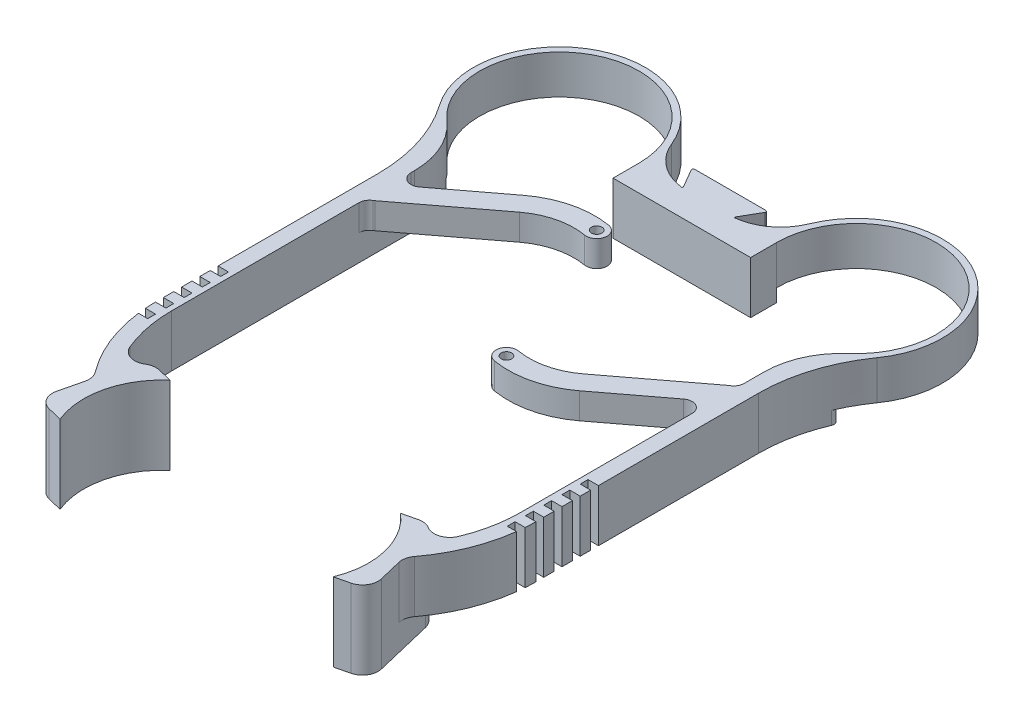
from build123d import *

# Parameters (mm, degrees)
BOSS_EXTRUDE1_DEPTH = 10
FILLET2_R           = 30
SKETCH6_R           = 1
BOSS_EXTRUDE2_DEPTH = 5
SKETCH4_W           = 2
SKETCH4_H           = 1.5
CUT_EXTRUDE1_DEPTH  = 99.900202224
FILLET3_R           = 15
CUT_REVOLVE1_START  = -1
CUT_REVOLVE1_DEPTH  = 3.5
FILLET1_R           = 10
FILLET4_R           = 1
FILLET5_R           = 2
BOSS_EXTRUDE3_START = -10
BOSS_EXTRUDE3_DEPTH = 15
DELETEFACE1_DEPTH   = 11
FILLET6_R           = 3
FILLET7_R           = 3
BOSS_EXTRUDE4_START = -10
SKETCH11_W          = 10
SKETCH11_H          = 0.3
BOSS_EXTRUDE4_DEPTH = 8
FILLET8_R           = 0.3


with BuildPart() as part:
    # Sketch2 → Boss-Extrude1 (new body)
    with BuildSketch(Plane(origin=(0, 0, 0), x_dir=(1, 0, 0), z_dir=(0, 1, 0))):
        with BuildLine():
            Line((-15, 2.5), (-15, -2.5))
            Line((-15, -2.5), (15, -2.5))
            Line((15, -2.5), (15, 2.5))
            Line((15, 2.5), (-12, 2.5))
            ThreePointArc((-12, 2.5), (-36.874067112, 16.717067208), (-36.5, -11.93086969))
            Line((-36.5, -11.93086969), (-36.5, -66.907529531))
            ThreePointArc((-36.5, -66.907529531), (-34.28320825, -78.052094241), (-27.970319449, -87.5))
            Line((-27.970319449, -87.5), (-25.848999105, -85.378679656))
            ThreePointArc((-25.848999105, -85.378679656), (-31.511569653, -76.904043944), (-33.5, -66.907529531))
            Line((-33.5, -66.907529531), (-33.5, -10.039936204))
            ThreePointArc((-33.5, -10.039936204), (-36.074628704, 13.674748319), (-15, 2.5))
        make_face()
    boss_extrude1 = extrude(amount=BOSS_EXTRUDE1_DEPTH)

    # Mirror2: Boss-Extrude1 across plane
    add(boss_extrude1.mirror(Plane(origin=(0, 0, 0), x_dir=(0, 0, 1), z_dir=(1, 0, 0))))

    # Fillet2
    fillet2_edges = [part.edges().sort_by_distance(p)[0] for p in [
        (-36.5, 5, 11.93086969),
        (36.5, 5, 11.93086969),
    ]]
    fillet(fillet2_edges, radius=FILLET2_R)

    # Sketch6 → Boss-Extrude2 (add)
    # profile 1 of 2: a face of its own
    with BuildSketch(Plane(origin=(0, 10, 0), x_dir=(1, 0, 0), z_dir=(0, 1, 0))):
        with BuildLine():
            Line((-32.29175747, -29.0937848), (-16.524124365, -17.1403988))
            ThreePointArc((-16.524124365, -17.1403988), (-11.748018495, -14.869514069), (-6.462616651, -14.688870483))
            ThreePointArc((-6.462616651, -14.688870483), (-4.151991915, -13.057609213), (-5.783253184, -10.746984477))
            ThreePointArc((-5.783253184, -10.746984477), (-12.694932518, -10.983210705), (-18.940609425, -13.9528292))
            Line((-18.940609425, -13.9528292), (-34.70824253, -25.9062152))
            ThreePointArc((-34.70824253, -25.9062152), (-35.0937848, -28.70824253), (-32.29175747, -29.0937848))
        make_face()
        with Locations(Location((-6.122934918, -12.71792748, 0), (0, 0, 270))):
            Circle(SKETCH6_R, mode=Mode.SUBTRACT)
    # profile 2 of 2: a face of its own
    with BuildSketch(Plane(origin=(0, 10, 0), x_dir=(1, 0, 0), z_dir=(0, 1, 0))):
        with BuildLine():
            Line((32.29175747, -25.9062152), (16.524124365, -37.8596012))
            ThreePointArc((16.524124365, -37.8596012), (11.748018495, -40.130485931), (6.462616651, -40.311129517))
            ThreePointArc((6.462616651, -40.311129517), (4.151991915, -41.942390787), (5.783253184, -44.253015523))
            ThreePointArc((5.783253184, -44.253015523), (12.694932518, -44.016789295), (18.940609425, -41.0471708))
            Line((18.940609425, -41.0471708), (34.70824253, -29.0937848))
            ThreePointArc((34.70824253, -29.0937848), (35.0937848, -26.29175747), (32.29175747, -25.9062152))
        make_face()
        with Locations(Location((6.122934918, -42.28207252, 0), (0, 0, 270))):
            Circle(SKETCH6_R, mode=Mode.SUBTRACT)
    extrude(amount=-BOSS_EXTRUDE2_DEPTH)

    # Sketch4 → Cut-Extrude1 (cut, through all)
    with BuildSketch(Plane(origin=(0, 10, 0), x_dir=(1, 0, 0), z_dir=(0, 1, 0))):
        with BuildLine():
            Line((-13.2, 2.5), (-13.2, -2.5))
            Line((-13.2, -2.5), (-14.040055325, -2.5))
            ThreePointArc((-14.040055325, -2.5), (-43.588524672, 5.0350391), (-13.2, 2.5))
        make_face()
        with Locations((-35.5, -59.25)):
            Rectangle(SKETCH4_W, SKETCH4_H)
        with Locations((-35.5, -62.75)):
            Rectangle(SKETCH4_W, SKETCH4_H)
        with Locations((-35.5, -55.75)):
            Rectangle(SKETCH4_W, SKETCH4_H)
        with Locations((-35.5, -66.25)):
            Rectangle(SKETCH4_W, SKETCH4_H)
        with Locations((-35.5, -69.75)):
            Rectangle(SKETCH4_W, SKETCH4_H)
        with Locations((35.5, -69.75)):
            Rectangle(SKETCH4_W, SKETCH4_H)
        with Locations((35.5, -66.25)):
            Rectangle(SKETCH4_W, SKETCH4_H)
        with Locations((35.5, -62.75)):
            Rectangle(SKETCH4_W, SKETCH4_H)
        with Locations((35.5, -55.75)):
            Rectangle(SKETCH4_W, SKETCH4_H)
        with Locations((35.5, -59.25)):
            Rectangle(SKETCH4_W, SKETCH4_H)
        with BuildLine():
            Line((13.2, -2.5), (14.040055325, -2.5))
            ThreePointArc((14.040055325, -2.5), (43.588524672, 5.0350391), (13.2, 2.5))
            Line((13.2, 2.5), (13.2, -2.5))
        make_face()
    extrude(amount=-CUT_EXTRUDE1_DEPTH, mode=Mode.SUBTRACT)

    # Fillet3
    fillet3_edges = [part.edges().sort_by_distance(p)[0] for p in [
        (33.5, 5, 11.959944675),
        (-33.5, 5, 11.959944675),
    ]]
    fillet(fillet3_edges, radius=FILLET3_R)

    # Cut-Revolve1: read off the stored shape, not the designer's step
    # Cut-Revolve1 outline → Cut-Revolve1 (cut)
    with BuildSketch(Plane(origin=(0, 0, 0), x_dir=(1, 0, 0), z_dir=(0, 1, 0)).offset(CUT_REVOLVE1_START)):
        with BuildLine():
            ThreePointArc((-41.983870968, -7.00974362), (-39.626617248, -9.683939782), (-36.75, -11.789419162))
            Line((-36.75, -11.789419162), (-36.469117037, -11.3029156))
            ThreePointArc((-36.469117037, -11.3029156), (-37.473434742, -10.092280811), (-38.599009901, -8.993476368))
            ThreePointArc((-38.599009901, -8.993476368), (-34.807739235, 16.439240501), (-13.2, 2.5))
            Line((-13.2, 2.5), (-12, 2.5))
            ThreePointArc((-12, 2.5), (-33.488292745, 18.227903086), (-41.983870968, -7.00974362))
        make_face()
    cut_revolve1 = extrude(amount=CUT_REVOLVE1_DEPTH, mode=Mode.SUBTRACT)

    # Mirror3: Cut-Revolve1 across plane
    add(cut_revolve1.mirror(Plane(origin=(0, 0, 0), x_dir=(0, 0, 1), z_dir=(1, 0, 0))), mode=Mode.SUBTRACT)

    # Fillet1
    fillet1_edges = [part.edges().sort_by_distance(p)[0] for p in [
        (-12, 6.25, -2.5),
        (12, 6.25, -2.5),
    ]]
    fillet(fillet1_edges, radius=FILLET1_R)

    # Fillet4
    # the kernel refuses this fillet: 1 mm, written as the material it takes off along each edge
    with BuildSketch(Plane(origin=(41.983870968, -16.048184468, 7.00974362), x_dir=(-0.7225326531123375, 0, 0.6913367957706624), z_dir=(0, 1, 0))) as fillet4_piece_1:
        with BuildLine():
            CenterArc((6.528208905, 0.981393724), FILLET4_R, 113.353303502, 145.576812808)
            ThreePointArc((6.131809124, 1.899471723), (3.116855905, 0.785256492), (0, 0))
            ThreePointArc((0, 0), (3.168101381, 0.307003562), (6.336202761, 0))
        make_face()
    extrude(amount=18.548184468, mode=Mode.SUBTRACT)
    with BuildSketch(Plane(origin=(-41.983870968, -16.048184468, 7.00974362), x_dir=(0.7225326531123378, 0, 0.6913367957706622), z_dir=(0, 1, 0))) as fillet4_piece_2:
        with BuildLine():
            CenterArc((6.528208905, -0.981393724), FILLET4_R, 101.06988369, 145.576812808)
            ThreePointArc((6.131809124, -1.899471723), (3.116855905, -0.785256492), (0, 0))
            ThreePointArc((0, 0), (3.168101381, -0.307003562), (6.336202761, 0))
        make_face()
    extrude(amount=18.548184468, mode=Mode.SUBTRACT)

    # Fillet5
    fillet5_edges = [part.edges().sort_by_distance(p)[0] for p in [
        (-33.5, 7.5, 29.5),
        (-33.5, 7.5, 24.99025088),
        (33.5, 7.5, 25.5),
        (33.5, 7.5, 30.00974912),
    ]]
    fillet(fillet5_edges, radius=FILLET5_R)

    # Sketch8 → Boss-Extrude3 (add)
    with BuildSketch(Plane.XZ.offset(BOSS_EXTRUDE3_START)):
        with BuildLine():
            Line((-26.213914484, 95.605099549), (-31.869667291, 94.247080891))
            Line((-31.869667291, 94.247080891), (-27.783825698, 77.230738791))
            Line((-27.783825698, 77.230738791), (-22.128072891, 78.588757448))
            ThreePointArc((-22.128072891, 78.588757448), (-26.909659277, 86.439339828), (-26.213914484, 95.605099549))
        make_face()
    boss_extrude3 = extrude(amount=BOSS_EXTRUDE3_DEPTH)

    # Mirror4: Boss-Extrude3 across plane
    add(boss_extrude3.mirror(Plane(origin=(0, 0, 0), x_dir=(0, 0, 1), z_dir=(1, 0, 0))))

    # DeleteFace1: read off the stored shape, not the designer's step
    # DeleteFace1 outline → DeleteFace1 (cut)
    with BuildSketch(Plane(origin=(0, 0, 0), x_dir=(1, 0, 0), z_dir=(0, 1, 0))):
        with BuildLine():
            Line((25.848999105, -85.378679656), (26.909659277, -86.439339828))
            ThreePointArc((26.909659277, -86.439339828), (26.685366049, -85.610488056), (26.414012779, -84.795828548))
            ThreePointArc((26.414012779, -84.795828548), (26.133770133, -85.089449001), (25.848999105, -85.378679656))
        make_face()
        with BuildLine():
            Line((-26.909659277, -86.439339828), (-25.848999105, -85.378679656))
            ThreePointArc((-25.848999105, -85.378679656), (-26.133770133, -85.089449001), (-26.414012779, -84.795828548))
            ThreePointArc((-26.414012779, -84.795828548), (-26.685366049, -85.610488056), (-26.909659277, -86.439339828))
        make_face()
    extrude(amount=DELETEFACE1_DEPTH, mode=Mode.SUBTRACT)

    # Fillet6
    fillet6_edges = [part.edges().sort_by_distance(p)[0] for p in [
        (-31.869667291, 2.5, 94.247080891),
        (-29.774582906, 5, 85.521663663),
        (-27.783825698, 2.5, 77.230738791),
        (29.774582906, 5, 85.521663663),
        (27.783825698, 2.5, 77.230738791),
        (31.869667291, 2.5, 94.247080891),
    ]]
    fillet(fillet6_edges, radius=FILLET6_R)

    # Fillet7
    # the kernel refuses this fillet: 3 mm, written as the material it adds along each edge
    with BuildSketch(Plane(origin=(28.870158832, 10, 81.755000397), x_dir=(-0.4451552484524621, 0, -0.8954534073726151), z_dir=(0, -1, 0))) as fillet7_piece_1:
        with BuildLine():
            CenterArc((5.429938119, 2.554031947), FILLET7_R, 138.932760823, 99.425389741)
            Line((3.168120681, 4.524864735), (2.941938938, 4.721948013))
            ThreePointArc((2.941938938, 4.721948013), (1.218371107, 2.518472645), (-0.262566045, 0.145117443))
            Line((-0.262566045, 0.145117443), (0.067135427, -0.292391577))
            ThreePointArc((0.067135427, -0.292391577), (1.678072021, 0.077492249), (3.698732127, -0.255403195))
            Line((3.698732127, -0.255403195), (3.85611449, 0))
        make_face()
    extrude(amount=10)
    with BuildSketch(Plane(origin=(-28.870158832, 10, 81.755000397), x_dir=(-0.47821106545327013, 0, -0.8782449412766623), z_dir=(0, -1, 0))) as fillet7_piece_2:
        with BuildLine():
            CenterArc((5.206526078, 2.983185104), FILLET7_R, 176.643750304, 99.425389741)
            Line((2.21167161, 3.158817444), (1.912186163, 3.176380678))
            ThreePointArc((1.912186163, 3.176380678), (1.025936374, 1.330182436), (-0.201013248, 0.222696372))
            Line((-0.201013248, 0.222696372), (-0.031718549, -0.29831851))
            ThreePointArc((-0.031718549, -0.29831851), (2.761855785, -0.446413754), (5.55543012, -0.29831851))
            Line((5.55543012, -0.29831851), (5.523711571, 0))
        make_face()
    extrude(amount=10)

    # Sketch11 → Boss-Extrude4 (add)
    with BuildSketch(Plane.XZ.offset(BOSS_EXTRUDE4_START)):
        Polygon((-7.309401077, -6.8), (7.309401077, -6.8), (5, -2.8), (-5, -2.8), align=None)
        with Locations((0, -2.65)):
            Rectangle(SKETCH11_W, SKETCH11_H)
    extrude(amount=BOSS_EXTRUDE4_DEPTH)

    # Fillet8
    fillet8_edges = [part.edges().sort_by_distance(p)[0] for p in [
        (-7.309401077, 6, -6.8),
        (7.309401077, 6, -6.8),
    ]]
    fillet(fillet8_edges, radius=FILLET8_R)


solid = part.part
